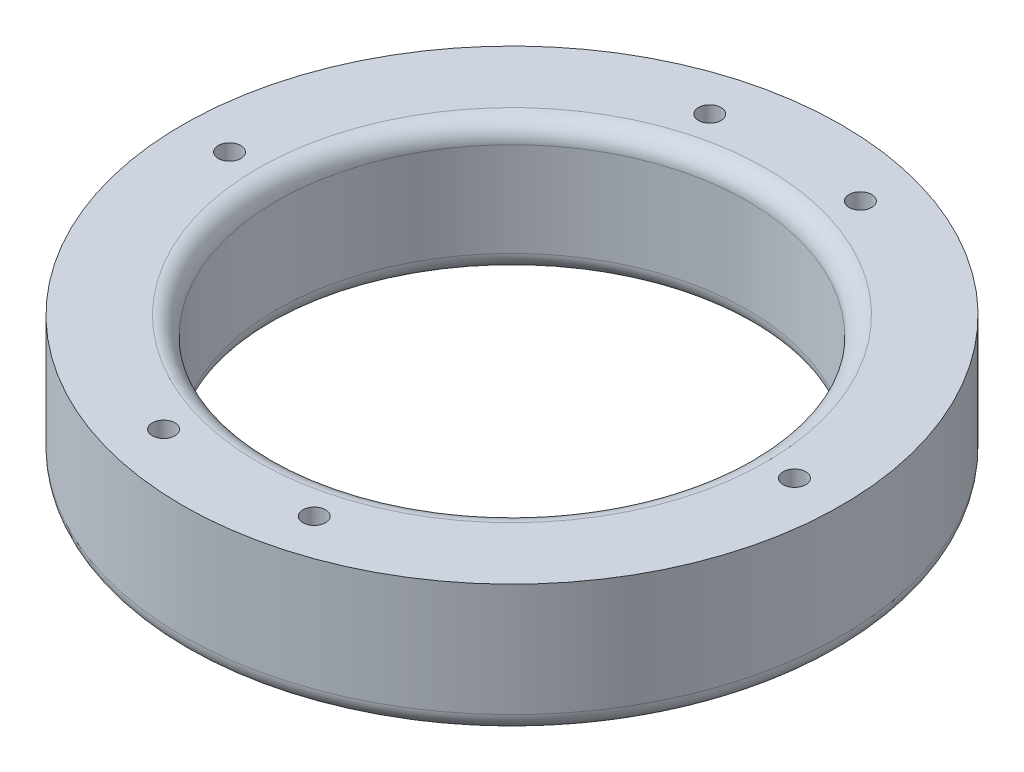
from build123d import *

# Parameters (mm, degrees)
SKETCH1_R           = 17.5
SKETCH1_R_2         = 0.6
SKETCH1_R_3         = 12.5
BOSS_EXTRUDE1_DEPTH = 7
FILLET1_R           = 1


with BuildPart() as part:
    # Sketch1 → Boss-Extrude1 (new body)
    with BuildSketch(Plane(origin=(0, 0, 0), x_dir=(1, 0, 0), z_dir=(0, 1, 0))):
        Circle(SKETCH1_R)
        with Locations((-4, 14.5)):
            Circle(SKETCH1_R_2, mode=Mode.SUBTRACT)
        with Locations((-4, -14.5)):
            Circle(SKETCH1_R_2, mode=Mode.SUBTRACT)
        with Locations((15, 0)):
            Circle(SKETCH1_R_2, mode=Mode.SUBTRACT)
        with Locations((-15, 0)):
            Circle(SKETCH1_R_2, mode=Mode.SUBTRACT)
        with Locations((4, 14.5)):
            Circle(SKETCH1_R_2, mode=Mode.SUBTRACT)
        with Locations((4, -14.5)):
            Circle(SKETCH1_R_2, mode=Mode.SUBTRACT)
        Circle(SKETCH1_R_3, mode=Mode.SUBTRACT)
    extrude(amount=BOSS_EXTRUDE1_DEPTH)

    # Fillet1
    fillet1_edges = [part.edges().sort_by_distance(p)[0] for p in [
        (-17.5, 0, 0),
        (-12.5, 0, 0),
        (-12.5, 7, 0),
    ]]
    fillet(fillet1_edges, radius=FILLET1_R)


solid = part.part
